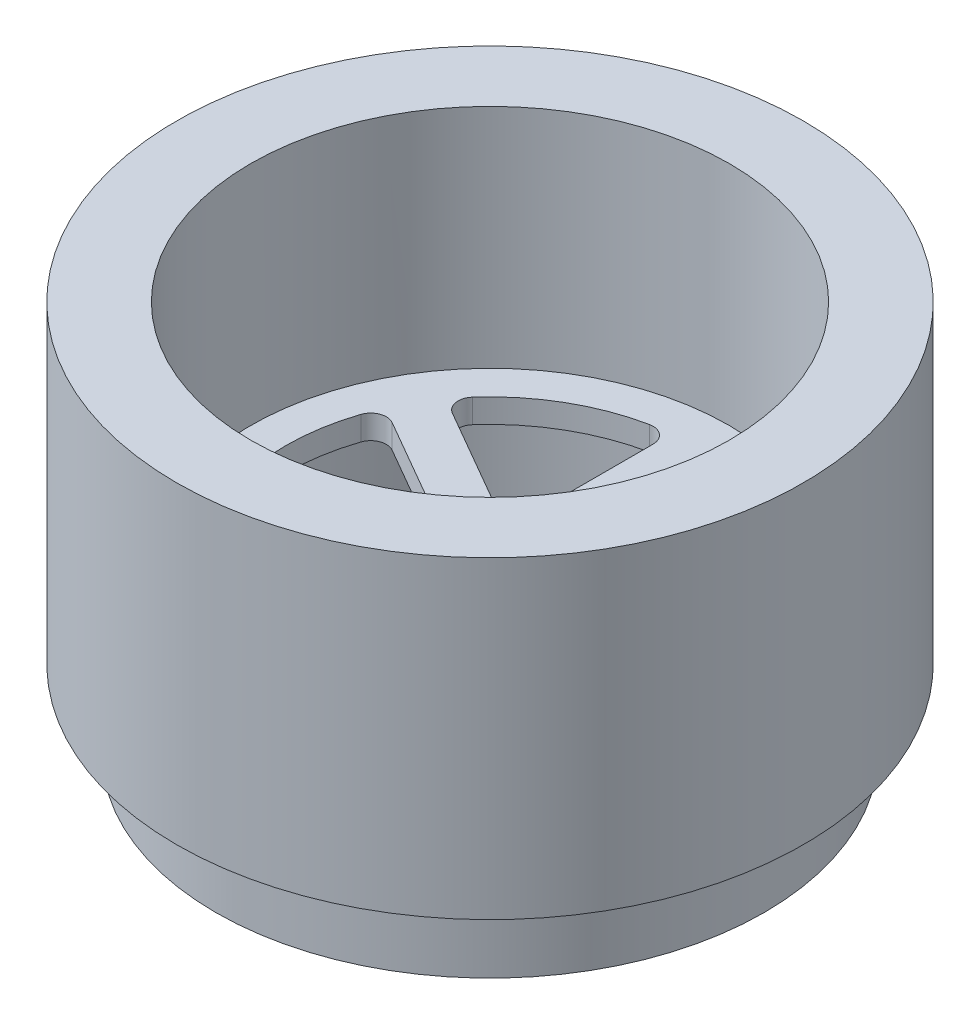
from build123d import *

# Parameters (mm, degrees)
SKETCH1_R           = 20
SKETCH1_R_2         = 15.28
BOSS_EXTRUDE1_DEPTH = 25
SKETCH3_R           = 20
BOSS_EXTRUDE2_DEPTH = 1.524
SKETCH4_R           = 2
SKETCH4_R_2         = 0.756
BOSS_EXTRUDE3_DEPTH = 3.5
SKETCH5_OUTSIDE_W   = 54.37
SKETCH5_OUTSIDE_H   = 54.37
SKETCH5_OUTSIDE_R   = 17.5
CUT_EXTRUDE1_DEPTH  = 5
CUT_EXTRUDE2_REACH  = 34.496
CIRPATTERN1_COUNT   = 6


with BuildPart() as part:
    # Sketch1 → Boss-Extrude1 (new body)
    with BuildSketch(Plane(origin=(0, 0, 0), x_dir=(1, 0, 0), z_dir=(0, 1, 0))):
        Circle(SKETCH1_R)
        Circle(SKETCH1_R_2, mode=Mode.SUBTRACT)
    extrude(amount=BOSS_EXTRUDE1_DEPTH)

    # Sketch3 → Boss-Extrude2 (add)
    with BuildSketch(Plane(origin=(0, 9, 0), x_dir=(-1, 0, 0), z_dir=(0, -1, 0))):
        Circle(SKETCH3_R)
    extrude(amount=-BOSS_EXTRUDE2_DEPTH)

    # Sketch4 → Boss-Extrude3 (add)
    with BuildSketch(Plane(origin=(0, 9, 0), x_dir=(-1, 0, 0), z_dir=(0, -1, 0))):
        Circle(SKETCH4_R)
        Circle(SKETCH4_R_2, mode=Mode.SUBTRACT)
    extrude(amount=BOSS_EXTRUDE3_DEPTH)

    # Sketch5 outside → Cut-Extrude1 (cut)
    with BuildSketch(Plane(origin=(0, 0, 0), x_dir=(1, 0, 0), z_dir=(0, 1, 0))):
        Rectangle(SKETCH5_OUTSIDE_W, SKETCH5_OUTSIDE_H)
        Circle(SKETCH5_OUTSIDE_R, mode=Mode.SUBTRACT)
    extrude(amount=CUT_EXTRUDE1_DEPTH, mode=Mode.SUBTRACT)

    # Sketch6 → Cut-Extrude2 (cut, up to next)
    with BuildSketch(Plane(origin=(0, 9, 0), x_dir=(-1, 0, 0), z_dir=(0, -1, 0)), mode=Mode.PRIVATE) as cut_extrude2_sk1:
        with BuildLine():
            Line((1.407875074, -4.358954791), (1.407875074, -11.807537338))
            ThreePointArc((1.407875074, -11.807537338), (1.775346224, -12.582074137), (2.607689581, -12.787371081))
            ThreePointArc((2.607689581, -12.787371081), (6.525275935, -11.302109452), (9.770343413, -8.652010962))
            ThreePointArc((9.770343413, -8.652010962), (10.008722723, -7.828531999), (9.521689754, -7.123024249))
            Line((9.521689754, -7.123024249), (3.071028046, -3.398732975))
            ThreePointArc((3.071028046, -3.398732975), (2.561569761, -3.26480311), (2.054736008, -3.408345785))
            ThreePointArc((2.054736008, -3.408345785), (1.989897048, -3.44660279), (1.924346031, -3.483626473))
            ThreePointArc((1.924346031, -3.483626473), (1.546617551, -3.850786041), (1.407875074, -4.358954791))
        make_face()
    cut_extrude2_tool1 = extrude(cut_extrude2_sk1.sketch, amount=-CUT_EXTRUDE2_REACH, mode=Mode.PRIVATE) & part.part
    cut_extrude2 = cut_extrude2_tool1.solids().sort_by_distance((-4.727395, 9, 8.188088))[0]
    add(cut_extrude2, mode=Mode.SUBTRACT)

    # CirPattern1: Cut-Extrude2 ×6 about axis
    cirpattern1_axis = Axis((0, 5.5, 0), (0, -1, 0))
    for i in range(1, CIRPATTERN1_COUNT):
        add(cut_extrude2.rotate(cirpattern1_axis, i * 360 / CIRPATTERN1_COUNT), mode=Mode.SUBTRACT)


solid = part.part
